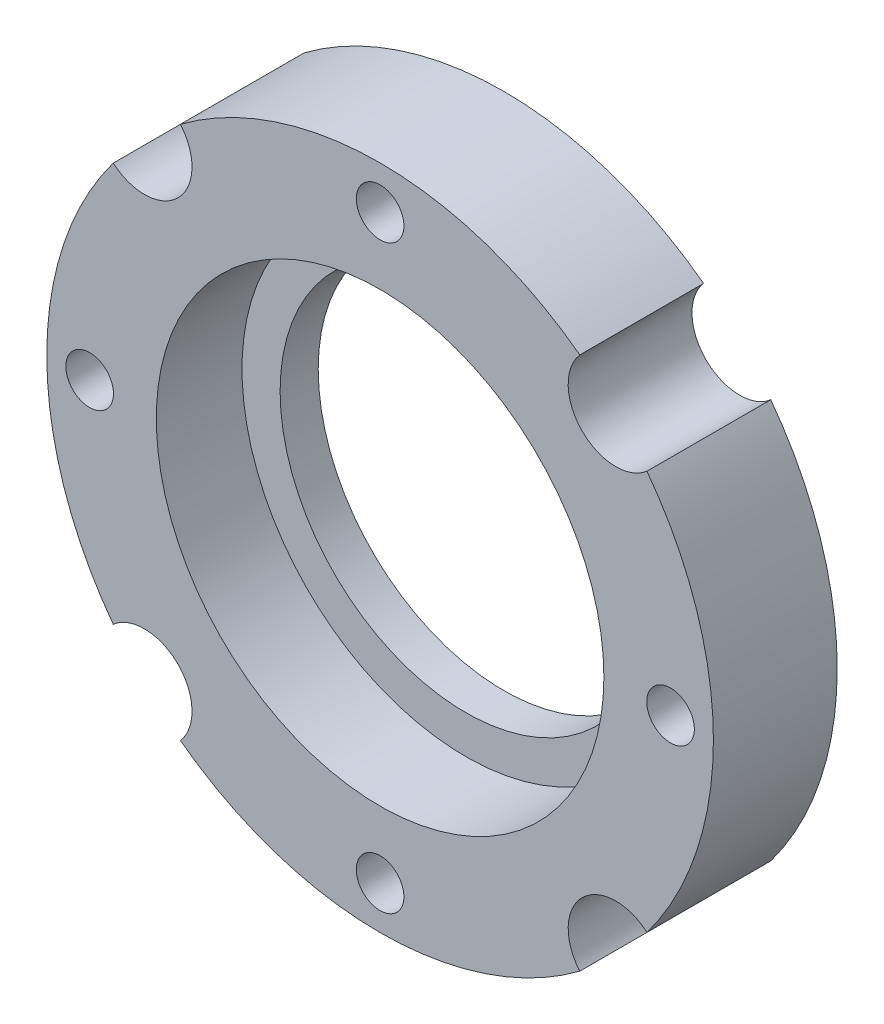
from build123d import *

# Parameters (mm, degrees)
SZKIC1_R                    = 35
SZKIC1_R_2                  = 19.5
DODANIE_WYCI_GNI_CIE1_DEPTH = 13
OTWORY_USTALAJ_CE_5_0MM1_D  = 5
WYTNIJ_WYCI_GNI_CIE1_START  = -9
SZKIC6_R                    = 23.5
SZKIC6_R_2                  = 19.5
WYTNIJ_WYCI_GNI_CIE1_DEPTH  = 9
SZKIC2_R                    = 5
WYTNIJ_WYCI_GNI_CIE2_DEPTH  = 14


with BuildPart() as part:
    # Szkic1 → Dodanie-wyciągnięcie1 (new body)
    with BuildSketch(Plane.XY):
        Circle(SZKIC1_R)
        Circle(SZKIC1_R_2, mode=Mode.SUBTRACT)
    extrude(amount=DODANIE_WYCI_GNI_CIE1_DEPTH)

    # Otwory ustalające Ø5.0mm1 (through all)
    with Locations(Plane.XY.offset(13)):
        with Locations((0, 30.5), (0, -30.5), (-30.5, 0), (30.5, 0)):
            Hole(OTWORY_USTALAJ_CE_5_0MM1_D / 2)

    # Szkic6 → Wytnij-wyciągnięcie1 (cut)
    with BuildSketch(Plane.XY.offset(13).offset(WYTNIJ_WYCI_GNI_CIE1_START)):
        Circle(SZKIC6_R)
        Circle(SZKIC6_R_2, mode=Mode.SUBTRACT)
    extrude(amount=WYTNIJ_WYCI_GNI_CIE1_DEPTH, mode=Mode.SUBTRACT)

    # Szkic2 → Wytnij-wyciągnięcie2 (cut)
    with BuildSketch(Plane.XY.offset(13)):
        with Locations((24.748737342, 24.748737342)):
            Circle(SZKIC2_R)
        with Locations((24.748737342, -24.748737342)):
            Circle(SZKIC2_R)
        with Locations((-24.748737342, -24.748737342)):
            Circle(SZKIC2_R)
        with Locations((-24.748737342, 24.748737342)):
            Circle(SZKIC2_R)
    extrude(amount=-WYTNIJ_WYCI_GNI_CIE2_DEPTH, mode=Mode.SUBTRACT)


solid = part.part
